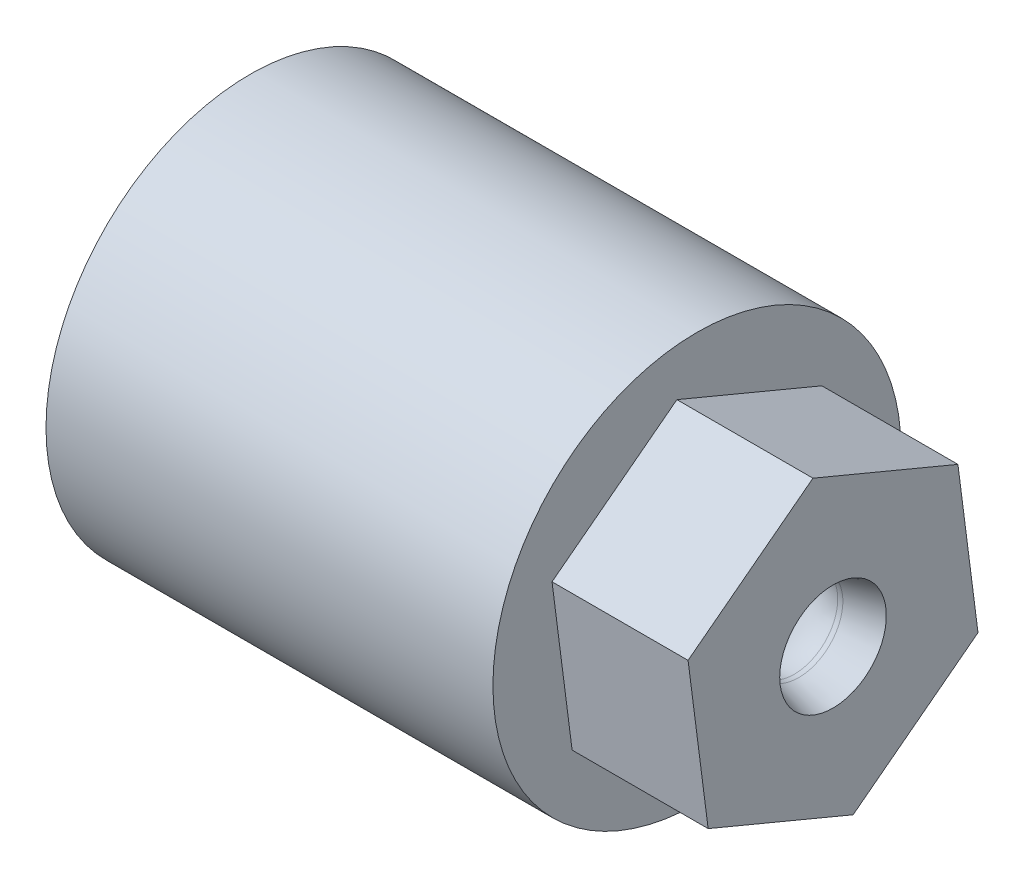
from build123d import *

# Parameters (mm, degrees)
CUT_EXTRUDE2_START = -6.35
SKETCH3_R          = 9.525
CUT_EXTRUDE2_DEPTH = 6.35


with BuildPart() as part:
    # Sketch1 → Revolve1 (revolve)
    with BuildSketch(Plane.XY):
        with BuildLine():
            Line((0.21036812, 2.059695488), (1.811366005, 2.488681579))
            Line((1.811366005, 2.488681579), (1.811366005, 9.525))
            Line((1.811366005, 9.525), (-10.888633995, 9.525))
            Line((-10.888633995, 9.525), (-25.4, 9.525))
            Line((-25.4, 9.525), (-25.4, 5.747363917))
            Line((-25.4, 5.747363917), (-6.293014916, 5.747363917))
            ThreePointArc((-6.293014916, 5.747363917), (-5.077995018, 5.505681433), (-4.047950886, 4.817427948))
            Line((-4.047950886, 4.817427948), (-2.155261469, 2.924738531))
            ThreePointArc((-2.155261469, 2.924738531), (-1.166419102, 2.264015185), (0, 2.032))
            ThreePointArc((0, 2.032), (0.106091689, 2.038953617), (0.21036812, 2.059695488))
        make_face()
    revolve(axis=Axis((0, 0, 0), (1, 0, 0)))

    # Sketch3 → Cut-Extrude2 (cut)
    with BuildSketch(Plane(origin=(1.811366005, 0, 0), x_dir=(0, 0, -1), z_dir=(1, 0, 0)).offset(CUT_EXTRUDE2_START)):
        Circle(SKETCH3_R)
        Polygon((6.766607905, -2.824243403), (0.937437419, -7.272176044), (-5.829170486, -4.447932641), (-6.766607905, 2.824243403), (-0.937437419, 7.272176044), (5.829170486, 4.447932641), align=None, mode=Mode.SUBTRACT)
    extrude(amount=CUT_EXTRUDE2_DEPTH, mode=Mode.SUBTRACT)


solid = part.part
